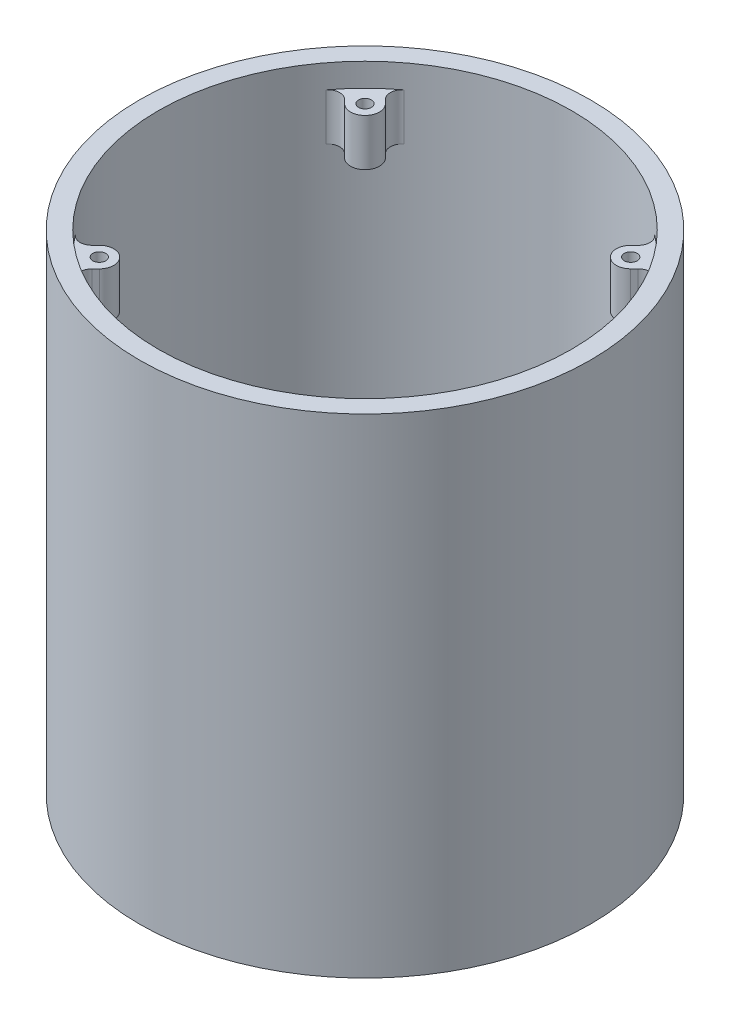
from build123d import *

# Parameters (mm, degrees)
SKETCH1_R             = 96
SKETCH1_R_2           = 88
BOSS_EXTRUDE3_DEPTH   = 208
BOSS_EXTRUDE4_DEPTH   = 60
BOSS_EXTRUDE4_2_DEPTH = 60
BOSS_EXTRUDE4_3_DEPTH = 60
BOSS_EXTRUDE4_4_DEPTH = 60
FILLET1_R             = 8
SKETCH3_R             = 2.75
CUT_EXTRUDE1_DEPTH    = 65
SKETCH5_R             = 2.75
BOSS_EXTRUDE5_DEPTH   = 20
FILLET3_R             = 5


with BuildPart() as part:
    # Sketch1 → Boss-Extrude3 (new body)
    with BuildSketch(Plane.XZ.offset(-872.688222755)):
        with Locations(Location((738.258051733, 1221.214475077, 0), (0, 0, 270))):
            Circle(SKETCH1_R)
        with Locations(Location((738.258051733, 1221.214475077, 0), (0, 0, 270))):
            Circle(SKETCH1_R_2, mode=Mode.SUBTRACT)
    extrude(amount=-BOSS_EXTRUDE3_DEPTH)


with BuildPart() as body_2:
    # Sketch2 → Boss-Extrude4 (new body)
    with BuildSketch(Plane(origin=(0, 882.688222755, 0), x_dir=(1, 0, 0), z_dir=(0, 1, 0))):
        with BuildLine():
            Line((658.258051733, -1213.714475077), (650.578236496, -1213.714475077))
            ThreePointArc((650.578236496, -1213.714475077), (650.258051733, -1221.214475077), (650.578236496, -1228.714475077))
            Line((650.578236496, -1228.714475077), (658.258051733, -1228.714475077))
            ThreePointArc((658.258051733, -1228.714475077), (665.758051733, -1221.214475077), (658.258051733, -1213.714475077))
        make_face()
    extrude(amount=BOSS_EXTRUDE4_DEPTH)


with BuildPart() as body_3:
    # Sketch2 → Boss-Extrude4 2 (new body)
    with BuildSketch(Plane(origin=(0, 882.688222755, 0), x_dir=(1, 0, 0), z_dir=(0, 1, 0))):
        with BuildLine():
            Line((730.758051733, -1301.214475077), (730.758051733, -1308.894290314))
            ThreePointArc((730.758051733, -1308.894290314), (738.258051733, -1309.214475077), (745.758051733, -1308.894290314))
            Line((745.758051733, -1308.894290314), (745.758051733, -1301.214475077))
            ThreePointArc((745.758051733, -1301.214475077), (738.258051733, -1293.714475077), (730.758051733, -1301.214475077))
        make_face()
    extrude(amount=BOSS_EXTRUDE4_2_DEPTH)


with BuildPart() as body_4:
    # Sketch2 → Boss-Extrude4 3 (new body)
    with BuildSketch(Plane(origin=(0, 882.688222755, 0), x_dir=(1, 0, 0), z_dir=(0, 1, 0))):
        with BuildLine():
            Line((818.258051733, -1228.714475077), (825.93786697, -1228.714475077))
            ThreePointArc((825.93786697, -1228.714475077), (826.258051733, -1221.214475077), (825.93786697, -1213.714475077))
            Line((825.93786697, -1213.714475077), (818.258051733, -1213.714475077))
            ThreePointArc((818.258051733, -1213.714475077), (810.758051733, -1221.214475077), (818.258051733, -1228.714475077))
        make_face()
    extrude(amount=BOSS_EXTRUDE4_3_DEPTH)


with BuildPart() as body_5:
    # Sketch2 → Boss-Extrude4 4 (new body)
    with BuildSketch(Plane(origin=(0, 882.688222755, 0), x_dir=(1, 0, 0), z_dir=(0, 1, 0))):
        with BuildLine():
            Line((730.758051733, -1141.214475077), (730.758051733, -1133.53465984))
            ThreePointArc((730.758051733, -1133.53465984), (738.258051733, -1133.214475077), (745.758051733, -1133.53465984))
            Line((745.758051733, -1133.53465984), (745.758051733, -1141.214475077))
            ThreePointArc((745.758051733, -1141.214475077), (738.258051733, -1148.714475077), (730.758051733, -1141.214475077))
        make_face()
    extrude(amount=BOSS_EXTRUDE4_4_DEPTH)

    # Combine1: union body 4, body 3, body 2, part
    add(body_4.part)
    add(body_3.part)
    add(body_2.part)
    add(part.part)

    # Fillet1
    # the kernel refuses this fillet: 8 mm, written as the material it adds along each edge
    with BuildSketch(Plane(origin=(745.758051733, 882.688222755, 1308.894290314), x_dir=(0.9902588501618923, 0, -0.13923867880745916), z_dir=(0, 1, 0)), Plane(origin=(650.578236496, 882.688222755, 1228.714475077), x_dir=(0.13923867880745078, 0, 0.9902588501618935), z_dir=(0, 1, 0)), Plane(origin=(825.93786697, 882.688222755, 1213.714475077), x_dir=(-0.13923867880746754, 0, -0.9902588501618913), z_dir=(0, 1, 0))) as fillet1_piece_1:
        with BuildLine():
            CenterArc((9.128280488, 7.988182101), FILLET1_R, 177.555452969, 95.559247246)
            Line((1.135560727, 8.329401712), (0.336288751, 8.363523673))
            ThreePointArc((0.336288751, 8.363523673), (0.277120247, 7.716395949), (-0.79220708, 0.111390943))
            Line((-0.79220708, 0.111390943), (-0.043468002, -0.79881821))
            ThreePointArc((-0.043468002, -0.79881821), (4.781480255, -0.92999689), (9.606428513, -0.79881821))
            Line((9.606428513, -0.79881821), (9.562960511, 0))
        make_face()
    extrude(amount=60)
    with BuildSketch(Plane(origin=(730.758051733, 882.688222755, 1308.894290314), x_dir=(-0.9902588501618917, 0, -0.1392386788074641), z_dir=(0, 1, 0)), Plane(origin=(650.578236496, 882.688222755, 1213.714475077), x_dir=(0.1392386788074475, 0, -0.990258850161894), z_dir=(0, 1, 0)), Plane(origin=(825.93786697, 882.688222755, 1228.714475077), x_dir=(-0.13923867880745916, 0, 0.9902588501618923), z_dir=(0, 1, 0))) as fillet1_piece_2:
        with BuildLine():
            CenterArc((9.128280488, -7.988182101), FILLET1_R, 86.885299786, 95.559247246)
            Line((1.135560727, -8.329401712), (0.336288751, -8.363523673))
            ThreePointArc((0.336288751, -8.363523673), (0.277120247, -7.716395949), (-0.79220708, -0.111390943))
            Line((-0.79220708, -0.111390943), (-0.043468002, 0.79881821))
            ThreePointArc((-0.043468002, 0.79881821), (4.781480255, 0.92999689), (9.606428513, 0.79881821))
            Line((9.606428513, 0.79881821), (9.562960511, 0))
        make_face()
    extrude(amount=60)
    with BuildSketch(Plane(origin=(745.758051733, 882.688222755, 1133.53465984), x_dir=(-0.004196280557394128, 0, 0.9999911955759828), z_dir=(0, 1, 0))) as fillet1_piece_3:
        with BuildLine():
            CenterArc((9.148032579, 7.965554461), FILLET1_R, 169.12193538, 95.559247246)
            Line((1.2917843, 9.475310394), (0.506159472, 9.626285987))
            ThreePointArc((0.506159472, 9.626285987), (-0.275580776, 4.863281082), (-0.797368322, 0.064836408))
            Line((-0.797368322, 0.064836408), (0.003357024, -0.799992956))
            ThreePointArc((0.003357024, -0.799992956), (7.683104645, -0.767766297), (8.332293668, -0.796555446))
            Line((8.332293668, -0.796555446), (8.406451751, 0))
        make_face()
    extrude(amount=60)
    with BuildSketch(Plane(origin=(730.758051733, 882.688222755, 1133.53465984), x_dir=(0.0041962805574076514, 0, 0.9999911955759828), z_dir=(0, 1, 0))) as fillet1_piece_4:
        with BuildLine():
            CenterArc((9.148032579, -7.965554461), FILLET1_R, 95.318817375, 95.559247246)
            Line((1.2917843, -9.475310394), (0.506159472, -9.626285987))
            ThreePointArc((0.506159472, -9.626285987), (-0.275580776, -4.863281082), (-0.797368322, -0.064836408))
            Line((-0.797368322, -0.064836408), (0.003357024, 0.799992956))
            ThreePointArc((0.003357024, 0.799992956), (7.683104645, 0.767766297), (8.332293668, 0.796555446))
            Line((8.332293668, 0.796555446), (8.406451751, 0))
        make_face()
    extrude(amount=60)

    # Sketch3 → Cut-Extrude1 (cut)
    with BuildSketch(Plane.XZ.offset(-882.688222755)):
        with Locations(Location((738.258051733, 1141.214475077, 0), (0, 0, 270))):
            Circle(SKETCH3_R)
        with Locations(Location((818.258051733, 1221.214475077, 0), (0, 0, 270))):
            Circle(SKETCH3_R)
        with Locations(Location((738.258051733, 1301.214475077, 0), (0, 0, 270))):
            Circle(SKETCH3_R)
        with Locations(Location((658.258051733, 1221.214475077, 0), (0, 0, 270))):
            Circle(SKETCH3_R)
    extrude(amount=-CUT_EXTRUDE1_DEPTH, mode=Mode.SUBTRACT)

    # Sketch5 → Boss-Extrude5 (add)
    # profile 1 of 4: a face of its own
    with BuildSketch(Plane(origin=(0, 1070.688222755, 0), x_dir=(1, 0, 0), z_dir=(0, 1, 0))):
        with BuildLine():
            Line((677.344338067, -1168.991103752), (671.839379876, -1163.486145561))
            ThreePointArc((671.839379876, -1163.486145561), (676.032654988, -1158.989078333), (680.529722217, -1154.79580322))
            Line((680.529722217, -1154.79580322), (686.034680408, -1160.300761412))
            ThreePointArc((686.034680408, -1160.300761412), (686.034680408, -1168.991103752), (677.344338067, -1168.991103752))
        make_face()
        with Locations(Location((681.689509238, -1164.645932582, 0), (0, 0, 270))):
            Circle(SKETCH5_R, mode=Mode.SUBTRACT)
    # profile 2 of 4: a face of its own
    with BuildSketch(Plane(origin=(0, 1070.688222755, 0), x_dir=(1, 0, 0), z_dir=(0, 1, 0))):
        with BuildLine():
            Line((677.344338068, -1273.437846402), (671.839379876, -1278.942804593))
            ThreePointArc((671.839379876, -1278.942804593), (676.032654988, -1283.439871821), (680.529722217, -1287.633146934))
            Line((680.529722217, -1287.633146934), (686.034680408, -1282.128188742))
            ThreePointArc((686.034680408, -1282.128188742), (686.034680408, -1273.437846402), (677.344338068, -1273.437846402))
        make_face()
        with Locations(Location((681.689509238, -1277.783017572, 0), (0, 0, 270))):
            Circle(SKETCH5_R, mode=Mode.SUBTRACT)
    # profile 3 of 4: a face of its own
    with BuildSketch(Plane(origin=(0, 1070.688222755, 0), x_dir=(1, 0, 0), z_dir=(0, 1, 0))):
        with BuildLine():
            Line((790.499100727, -1282.110511073), (796.005293833, -1287.616704179))
            ThreePointArc((796.005293833, -1287.616704179), (800.483448477, -1283.439871821), (804.660280835, -1278.961717178))
            Line((804.660280835, -1278.961717178), (799.154087729, -1273.455524071))
            ThreePointArc((799.154087729, -1273.455524071), (790.499100727, -1273.455524071), (790.499100727, -1282.110511073))
        make_face()
        with Locations(Location((794.826594228, -1277.783017572, 0), (0, 0, 270))):
            Circle(SKETCH5_R, mode=Mode.SUBTRACT)
    # profile 4 of 4: a face of its own
    with BuildSketch(Plane(origin=(0, 1070.688222755, 0), x_dir=(1, 0, 0), z_dir=(0, 1, 0))):
        with BuildLine():
            Line((790.499100727, -1160.318439081), (796.005293833, -1154.812245975))
            ThreePointArc((796.005293833, -1154.812245975), (800.483448477, -1158.989078333), (804.660280835, -1163.467232976))
            Line((804.660280835, -1163.467232976), (799.154087729, -1168.973426083))
            ThreePointArc((799.154087729, -1168.973426083), (790.499100727, -1168.973426083), (790.499100727, -1160.318439081))
        make_face()
        with Locations(Location((794.826594228, -1164.645932582, 0), (0, 0, 270))):
            Circle(SKETCH5_R, mode=Mode.SUBTRACT)
    extrude(amount=-BOSS_EXTRUDE5_DEPTH)

    # Fillet3
    fillet3_edges = [body_5.edges().sort_by_distance(p)[0] for p in [
        (671.839379876, 1060.688222755, 1163.486145561),
        (680.529722217, 1060.688222755, 1154.79580322),
        (680.529722217, 1060.688222755, 1287.633146934),
        (671.839379876, 1060.688222755, 1278.942804593),
        (804.660280835, 1060.688222755, 1278.961717178),
        (796.005293833, 1060.688222755, 1287.616704179),
        (796.005293833, 1060.688222755, 1154.812245975),
        (804.660280835, 1060.688222755, 1163.467232976),
    ]]
    fillet(fillet3_edges, radius=FILLET3_R)


solid = body_5.part
